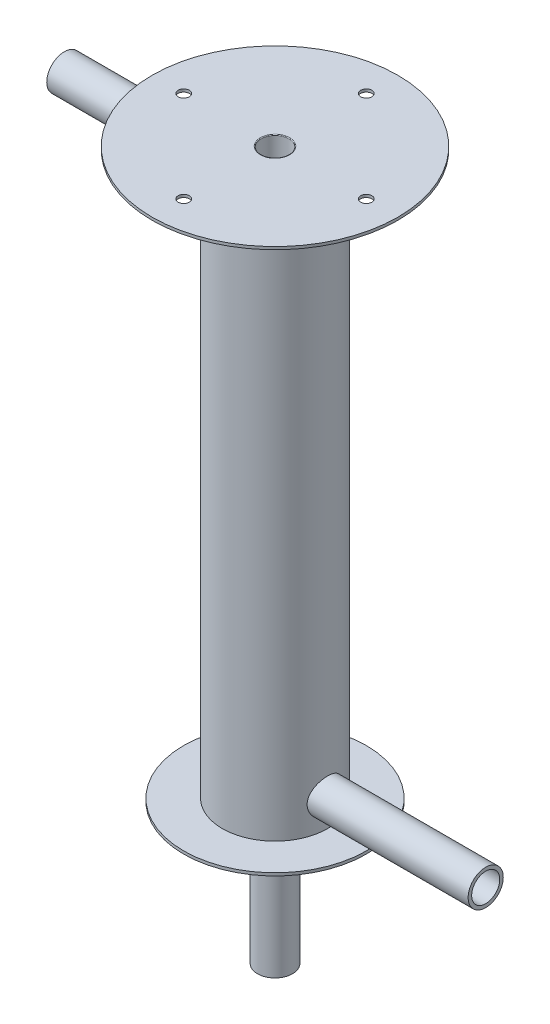
from build123d import *

# Parameters (mm, degrees)
SKETCH1_R                = 19.05
BOSS_EXTRUDE1_DEPTH      = 203.2
SKETCH2_R                = 33.02
BOSS_EXTRUDE2_DEPTH      = 1
BOSS_EXTRUDE3_START      = 1.016
SKETCH3_R                = 33.02
BOSS_EXTRUDE3_DEPTH      = 1.016
SHELL2_START             = -0.016
SHELL2_OUTLINE_R         = 18.05
SHELL2_DEPTH             = 204.216
BOSS_EXTRUDE4_REACH      = 235.917
BOSS_EXTRUDE4_END_RADIUS = 19.05
SKETCH4_R                = 6.35
CUT_EXTRUDE1_REACH       = 235.917
CUT_EXTRUDE1_END_RADIUS  = 18.05
SKETCH5_R                = 5.08
BOSS_EXTRUDE5_REACH      = 258.931
BOSS_EXTRUDE5_END_RADIUS = 19.05
SKETCH6_R                = 6.35
CUT_EXTRUDE3_REACH       = 223.383
SKETCH8_R                = 4
BOSS_EXTRUDE6_START      = 50.8
SKETCH9_R                = 6.35
BOSS_EXTRUDE6_DEPTH      = 255.016
CUT_EXTRUDE2_REACH       = 258.931
CUT_EXTRUDE2_END_RADIUS  = 18.05
SKETCH7_R                = 5.08
SKETCH11_R               = 44.45
BOSS_EXTRUDE7_DEPTH      = 1
CUT_EXTRUDE5_REACH       = 272.789
SKETCH13_R               = 2.032
CUT_EXTRUDE6_REACH       = 272.789
SKETCH15_R               = 5.08
FILLET1_R                = 0.254


# Read off the part's stored shape, not the designer's step: Shell2
with BuildPart() as part:
    # Sketch1 → Boss-Extrude1 (new body)
    with BuildSketch(Plane(origin=(0, 0, 0), x_dir=(1, 0, 0), z_dir=(0, 1, 0))):
        with Locations(Location((0, 0, 0), (0, 0, 270))):
            Circle(SKETCH1_R)
    extrude(amount=BOSS_EXTRUDE1_DEPTH)

    # Sketch2 → Boss-Extrude2 (add)
    with BuildSketch(Plane(origin=(0, 203.2, 0), x_dir=(1, 0, 0), z_dir=(0, 1, 0))):
        with Locations(Location((0, 0, 0), (0, 0, 270))):
            Circle(SKETCH2_R)
    extrude(amount=BOSS_EXTRUDE2_DEPTH)

    # Sketch3 → Boss-Extrude3 (add)
    with BuildSketch(Plane.XZ.offset(BOSS_EXTRUDE3_START)):
        with Locations(Location((0, 0, 0), (0, 0, 90))):
            Circle(SKETCH3_R)
    extrude(amount=-BOSS_EXTRUDE3_DEPTH)

    # Shell2 outline → Shell2 (cut)
    with BuildSketch(Plane(origin=(0, 0, 0), x_dir=(1, 0, 0), z_dir=(0, 1, 0)).offset(SHELL2_START)):
        Circle(SHELL2_OUTLINE_R)
    extrude(amount=SHELL2_DEPTH, mode=Mode.SUBTRACT)

    # Boss-Extrude4: up to this cylinder (the profile starts outside it)
    boss_extrude4_end = Plane(origin=(0, 189.341, 0), z_dir=(0, -1, 0)) * Cylinder(BOSS_EXTRUDE4_END_RADIUS, 510.934, mode=Mode.PRIVATE)
    # Sketch4 → Boss-Extrude4 (add, up to the surface)
    with BuildSketch(Plane(origin=(-76.2, 0, 0), x_dir=(0, 0, -1), z_dir=(1, 0, 0)), mode=Mode.PRIVATE) as boss_extrude4_sk1:
        with Locations(Location((0, 189.341, 0), (0, 0, 180))):
            Circle(SKETCH4_R)
    boss_extrude4_tool1 = extrude(boss_extrude4_sk1.sketch, amount=BOSS_EXTRUDE4_REACH, mode=Mode.PRIVATE) - boss_extrude4_end
    add(boss_extrude4_tool1.solids().sort_by_distance((-76.2, 189.341, 0))[0])

    # Cut-Extrude1: up to this cylinder (the profile starts outside it)
    cut_extrude1_end = Plane(origin=(0, 189.341, 0), z_dir=(0, -1, 0)) * Cylinder(CUT_EXTRUDE1_END_RADIUS, 508.934, mode=Mode.PRIVATE)
    # Sketch5 → Cut-Extrude1 (cut, up to the surface)
    with BuildSketch(Plane.ZY.offset(76.2), mode=Mode.PRIVATE) as cut_extrude1_sk1:
        with Locations((0, 189.341)):
            Circle(SKETCH5_R)
    cut_extrude1_tool1 = extrude(cut_extrude1_sk1.sketch, amount=-CUT_EXTRUDE1_REACH, mode=Mode.PRIVATE) - cut_extrude1_end
    add(cut_extrude1_tool1.solids().sort_by_distance((-76.2, 189.341, 0))[0], mode=Mode.SUBTRACT)

    # Boss-Extrude5: up to this cylinder (the profile starts outside it)
    boss_extrude5_end = Plane(origin=(0, 10.16, 0), z_dir=(0, -1, 0)) * Cylinder(BOSS_EXTRUDE5_END_RADIUS, 556.962, mode=Mode.PRIVATE)
    # Sketch6 → Boss-Extrude5 (add, up to the surface)
    with BuildSketch(Plane(origin=(76.2, 0, 0), x_dir=(0, 0, -1), z_dir=(1, 0, 0)), mode=Mode.PRIVATE) as boss_extrude5_sk1:
        with Locations((0, 10.16)):
            Circle(SKETCH6_R)
    boss_extrude5_tool1 = extrude(boss_extrude5_sk1.sketch, amount=-BOSS_EXTRUDE5_REACH, mode=Mode.PRIVATE) - boss_extrude5_end
    add(boss_extrude5_tool1.solids().sort_by_distance((76.2, 10.16, 0))[0])

    # Sketch8 → Cut-Extrude3 (cut, up to next)
    with BuildSketch(Plane.XZ.offset(1.016), mode=Mode.PRIVATE) as cut_extrude3_sk1:
        with Locations(Location((0, 0, 0), (0, 0, 270))):
            Circle(SKETCH8_R)
    cut_extrude3_tool1 = extrude(cut_extrude3_sk1.sketch, amount=-CUT_EXTRUDE3_REACH, mode=Mode.PRIVATE) & part.part
    add(cut_extrude3_tool1.solids().sort_by_distance((0, -1.016, 0))[0], mode=Mode.SUBTRACT)

    # Sketch9 → Boss-Extrude6 (add)
    with BuildSketch(Plane.XZ.offset(1.016).offset(BOSS_EXTRUDE6_START)):
        with Locations(Location((0, 0, 0), (0, 0, 270))):
            Circle(SKETCH9_R)
    extrude(amount=-BOSS_EXTRUDE6_DEPTH)

    # Cut-Extrude2: up to this cylinder (the profile starts outside it)
    cut_extrude2_end = Plane(origin=(0, 10.16, 0), z_dir=(0, -1, 0)) * Cylinder(CUT_EXTRUDE2_END_RADIUS, 554.962, mode=Mode.PRIVATE)
    # Sketch7 → Cut-Extrude2 (cut, up to the surface)
    with BuildSketch(Plane(origin=(76.2, 0, 0), x_dir=(0, 0, -1), z_dir=(1, 0, 0)), mode=Mode.PRIVATE) as cut_extrude2_sk1:
        with Locations((0, 10.16)):
            Circle(SKETCH7_R)
    cut_extrude2_tool1 = extrude(cut_extrude2_sk1.sketch, amount=-CUT_EXTRUDE2_REACH, mode=Mode.PRIVATE) - cut_extrude2_end
    add(cut_extrude2_tool1.solids().sort_by_distance((76.2, 10.16, 0))[0], mode=Mode.SUBTRACT)

    # Sketch11 → Boss-Extrude7 (add)
    with BuildSketch(Plane(origin=(0, 204.2, 0), x_dir=(1, 0, 0), z_dir=(0, 1, 0))):
        with Locations(Location((0, 0, 0), (0, 0, 270))):
            Circle(SKETCH11_R)
    extrude(amount=-BOSS_EXTRUDE7_DEPTH)

    # Sketch13 → Cut-Extrude5 (cut, up to next)
    with BuildSketch(Plane(origin=(0, 204.2, 0), x_dir=(1, 0, 0), z_dir=(0, 1, 0)), mode=Mode.PRIVATE) as cut_extrude5_sk1:
        with Locations(Location((33.02, 0, 0), (0, 0, 270))):
            Circle(SKETCH13_R)
    cut_extrude5_tool1 = extrude(cut_extrude5_sk1.sketch, amount=-CUT_EXTRUDE5_REACH, mode=Mode.PRIVATE) & part.part
    # Sketch13 → Cut-Extrude5 (cut, up to next)
    with BuildSketch(Plane(origin=(0, 204.2, 0), x_dir=(1, 0, 0), z_dir=(0, 1, 0)), mode=Mode.PRIVATE) as cut_extrude5_sk2:
        with Locations(Location((0, -33.02, 0), (0, 0, 270))):
            Circle(SKETCH13_R)
    cut_extrude5_tool2 = extrude(cut_extrude5_sk2.sketch, amount=-CUT_EXTRUDE5_REACH, mode=Mode.PRIVATE) & part.part
    # Sketch13 → Cut-Extrude5 (cut, up to next)
    with BuildSketch(Plane(origin=(0, 204.2, 0), x_dir=(1, 0, 0), z_dir=(0, 1, 0)), mode=Mode.PRIVATE) as cut_extrude5_sk3:
        with Locations(Location((-33.02, 0, 0), (0, 0, 270))):
            Circle(SKETCH13_R)
    cut_extrude5_tool3 = extrude(cut_extrude5_sk3.sketch, amount=-CUT_EXTRUDE5_REACH, mode=Mode.PRIVATE) & part.part
    # Sketch13 → Cut-Extrude5 (cut, up to next)
    with BuildSketch(Plane(origin=(0, 204.2, 0), x_dir=(1, 0, 0), z_dir=(0, 1, 0)), mode=Mode.PRIVATE) as cut_extrude5_sk4:
        with Locations(Location((0, 33.02, 0), (0, 0, 270))):
            Circle(SKETCH13_R)
    cut_extrude5_tool4 = extrude(cut_extrude5_sk4.sketch, amount=-CUT_EXTRUDE5_REACH, mode=Mode.PRIVATE) & part.part
    add(cut_extrude5_tool1.solids().sort_by_distance((33.02, 204.2, 0))[0], mode=Mode.SUBTRACT)
    add(cut_extrude5_tool2.solids().sort_by_distance((0, 204.2, 33.02))[0], mode=Mode.SUBTRACT)
    add(cut_extrude5_tool3.solids().sort_by_distance((-33.02, 204.2, 0))[0], mode=Mode.SUBTRACT)
    add(cut_extrude5_tool4.solids().sort_by_distance((0, 204.2, -33.02))[0], mode=Mode.SUBTRACT)

    # Sketch15 → Cut-Extrude6 (cut, up to next)
    with BuildSketch(Plane.XZ.offset(51.816), mode=Mode.PRIVATE) as cut_extrude6_sk1:
        with Locations(Location((0, 0, 0), (0, 0, 270))):
            Circle(SKETCH15_R)
    cut_extrude6_tool1 = extrude(cut_extrude6_sk1.sketch, amount=-CUT_EXTRUDE6_REACH, mode=Mode.PRIVATE) & part.part
    add(cut_extrude6_tool1.solids().sort_by_distance((0, -51.816, 0))[0], mode=Mode.SUBTRACT)

    # Fillet1
    fillet1_edges = [part.edges().sort_by_distance(p)[0] for p in [
        (0, 204.2, 5.08),
    ]]
    fillet(fillet1_edges, radius=FILLET1_R)


solid = part.part
